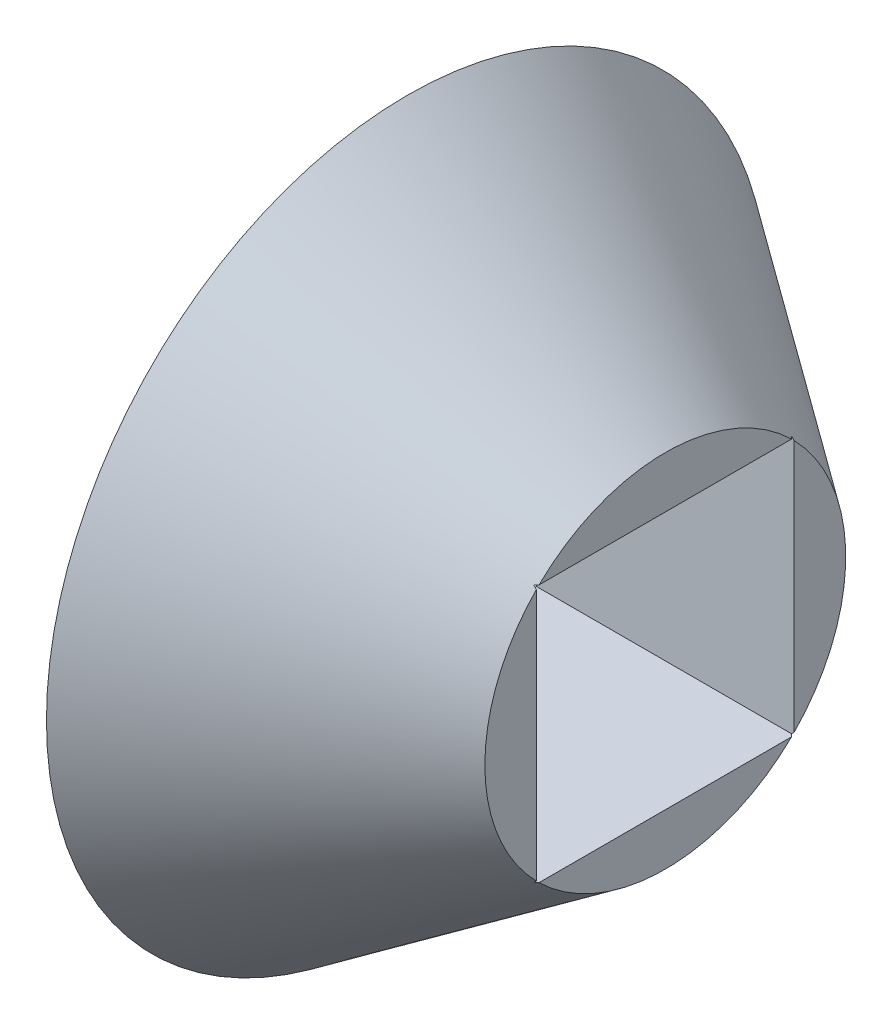
from build123d import *

# Parameters (mm, degrees)
SKETCH1_R           = 4.445
SKETCH1_W           = 3.175
SKETCH1_H           = 3.175
BOSS_EXTRUDE1_DEPTH = 3.175


with BuildPart() as part:
    # Sketch1 → Boss-Extrude1 (new body)
    with BuildSketch(Plane(origin=(0, 0, 0), x_dir=(0, 0, -1), z_dir=(1, 0, 0))):
        Circle(SKETCH1_R)
        Rectangle(SKETCH1_W, SKETCH1_H, mode=Mode.SUBTRACT)
    extrude(amount=BOSS_EXTRUDE1_DEPTH)

    # Sketch2 → Cut-Revolve1 (revolve, cut)
    with BuildSketch(Plane.XY):
        Polygon((0, 4.445), (3.175, 4.445), (3.175, 2.221841066), align=None)
    revolve(axis=Axis((0, 0, 0), (1, 0, 0)), mode=Mode.SUBTRACT)


solid = part.part
